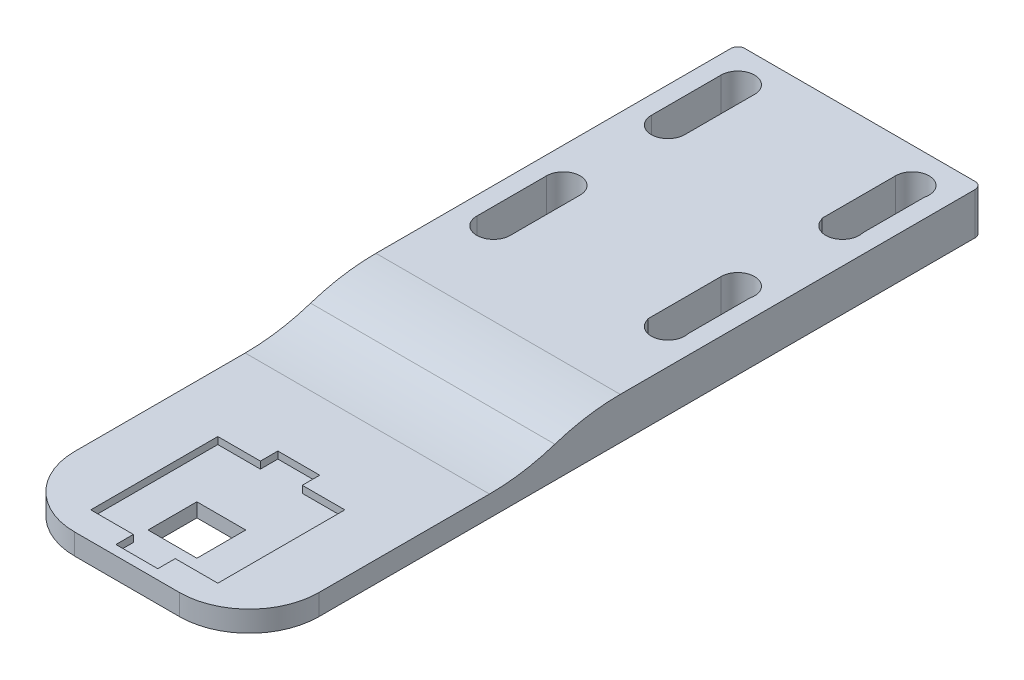
from build123d import *

# Parameters (mm, degrees)
SKETCH1_W            = 35
SKETCH1_H            = 105
BOSS_EXTRUDE1_DEPTH  = 6
M4_CLEARANCE_HOLE1_D = 4.8
LPATTERN2_COUNT      = 2
LPATTERN2_PITCH      = 10
SKETCH5_W            = 4.8
SKETCH5_H            = 10
SKETCH5_W_2          = 4.730666207
SKETCH5_H_2          = 10.572708501
CUT_EXTRUDE1_DEPTH   = 88.085432636
SKETCH6_W            = 18.2
SKETCH6_H            = 18.2
CUT_EXTRUDE2_DEPTH   = 4
SKETCH7_W            = 7
SKETCH7_H            = 7
CUT_EXTRUDE3_DEPTH   = 87.970527062
SKETCH8_W            = 6
SKETCH8_H            = 23.2
CUT_EXTRUDE4_DEPTH   = 4
FILLET1_R            = 10
CUT_EXTRUDE5_START   = -6
SKETCH9_W            = 37.049954943
SKETCH9_H            = 47.5
CUT_EXTRUDE5_DEPTH   = 3
FILLET2_R            = 30
FILLET3_R            = 30
FILLET4_R            = 1
SKETCH14_W           = 7
SKETCH14_H           = 2
BOSS_EXTRUDE2_DEPTH  = 7
SKETCH16_W           = 7
SKETCH16_H           = 7
CUT_EXTRUDE6_DEPTH   = 10


with BuildPart() as part:
    # Sketch1 → Boss-Extrude1 (new body)
    with BuildSketch(Plane(origin=(0, 0, 0), x_dir=(1, 0, 0), z_dir=(0, 1, 0))):
        with Locations((0.111940299, -32.574626866)):
            Rectangle(SKETCH1_W, SKETCH1_H)
    extrude(amount=BOSS_EXTRUDE1_DEPTH)

    # M4 Clearance Hole1 (through all)
    with Locations(Plane(origin=(0, 6, 0), x_dir=(1, 0, 0), z_dir=(0, 1, 0))):
        with Locations((-12.388059701, 14.925373134), (12.611940299, 14.925373134), (12.611940299, -10.074626866), (-12.388059701, -10.074626866)):
            m4_clearance_hole1 = Hole(M4_CLEARANCE_HOLE1_D / 2)

    # LPattern2: M4 Clearance Hole1 ×2
    with Locations(*[(0, 0, i * LPATTERN2_PITCH) for i in range(1, LPATTERN2_COUNT)]):
        add(m4_clearance_hole1, mode=Mode.SUBTRACT)

    # Sketch5 → Cut-Extrude1 (cut, through all)
    with BuildSketch(Plane(origin=(0, 6, 0), x_dir=(1, 0, 0), z_dir=(0, 1, 0))):
        with Locations((-12.388059701, 9.925373134)):
            Rectangle(SKETCH5_W, SKETCH5_H)
        with Locations((-12.388059701, -15.074626866)):
            Rectangle(SKETCH5_W, SKETCH5_H)
        with Locations((12.577273403, 9.639018884)):
            Rectangle(SKETCH5_W_2, SKETCH5_H_2)
        with Locations((12.577273403, -15.360981116)):
            Rectangle(SKETCH5_W_2, SKETCH5_H_2)
    extrude(amount=-CUT_EXTRUDE1_DEPTH, mode=Mode.SUBTRACT)

    # Sketch6 → Cut-Extrude2 (cut)
    with BuildSketch(Plane(origin=(0, 6, 0), x_dir=(1, 0, 0), z_dir=(0, 1, 0))):
        with Locations((0.111940299, -72.074626866)):
            Rectangle(SKETCH6_W, SKETCH6_H)
    extrude(amount=-CUT_EXTRUDE2_DEPTH, mode=Mode.SUBTRACT)

    # Sketch7 → Cut-Extrude3 (cut, through all)
    with BuildSketch(Plane(origin=(0, 2, 0), x_dir=(1, 0, 0), z_dir=(0, 1, 0))):
        with Locations((0.111940299, -72.074626866)):
            Rectangle(SKETCH7_W, SKETCH7_H)
    extrude(amount=-CUT_EXTRUDE3_DEPTH, mode=Mode.SUBTRACT)

    # Sketch8 → Cut-Extrude4 (cut)
    with BuildSketch(Plane(origin=(0, 6, 0), x_dir=(1, 0, 0), z_dir=(0, 1, 0))):
        with Locations((0.111940299, -72.074626866)):
            Rectangle(SKETCH8_W, SKETCH8_H)
    extrude(amount=-CUT_EXTRUDE4_DEPTH, mode=Mode.SUBTRACT)

    # Fillet1
    fillet1_edges = [part.edges().sort_by_distance(p)[0] for p in [
        (17.611940299, 3, 85.074626866),
        (-17.388059701, 3, 85.074626866),
    ]]
    fillet(fillet1_edges, radius=FILLET1_R)

    # Sketch9 → Cut-Extrude5 (cut)
    with BuildSketch(Plane.XZ.offset(CUT_EXTRUDE5_START)):
        with Locations((1.136917771, 61.324626866)):
            Rectangle(SKETCH9_W, SKETCH9_H)
    extrude(amount=CUT_EXTRUDE5_DEPTH, mode=Mode.SUBTRACT)

    # Fillet2
    # the kernel refuses this fillet: 30 mm, written as the material it adds along each edge
    with BuildSketch(Plane(origin=(-17.388059701, 3, 37.574626866), x_dir=(0, 1, 0), z_dir=(1, 0, 0))) as fillet2_piece_1:
        with BuildLine():
            CenterArc((30, 13.076696831), FILLET2_R, 180, 25.841932763)
            Line((0, 13.076696831), (-0.6, 13.076696831))
            Line((-0.6, 13.076696831), (-0.6, 0))
            Line((-0.6, 0), (0, -0.6))
            ThreePointArc((0, -0.6), (1.5, -0.6), (2.46, -0.261533937))
            Line((2.46, -0.261533937), (3, 0))
        make_face()
    extrude(amount=35)

    # Fillet3
    fillet3_edges = [part.edges().sort_by_distance(p)[0] for p in [
        (0.111940299, 6, 37.574626866),
    ]]
    fillet(fillet3_edges, radius=FILLET3_R)

    # Fillet4
    fillet4_edges = [part.edges().sort_by_distance(p)[0] for p in [
        (-17.388059701, 3, -19.925373134),
        (17.611940299, 3, -19.925373134),
    ]]
    fillet(fillet4_edges, radius=FILLET4_R)

    # Sketch14 → Boss-Extrude2 (add)
    with BuildSketch(Plane(origin=(-3.388059701, 0, 0), x_dir=(0, 0, -1), z_dir=(1, 0, 0))):
        with Locations((-72.074626866, 1)):
            Rectangle(SKETCH14_W, SKETCH14_H)
    extrude(amount=BOSS_EXTRUDE2_DEPTH)

    # Sketch16 → Cut-Extrude6 (cut)
    with BuildSketch(Plane(origin=(0, 3, 0), x_dir=(1, 0, 0), z_dir=(0, 1, 0))):
        with Locations((0.111940299, -75.074626866)):
            Rectangle(SKETCH16_W, SKETCH16_H)
    extrude(amount=-CUT_EXTRUDE6_DEPTH, mode=Mode.SUBTRACT)


solid = part.part
